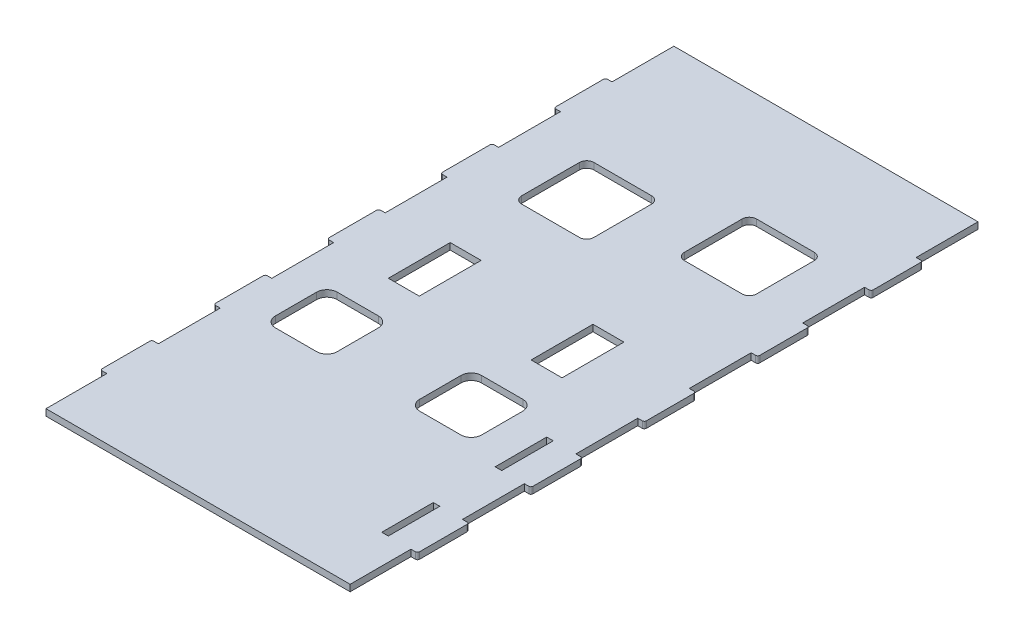
from build123d import *

# Parameters (mm, degrees)
BOSS_EXTRUDE1_DEPTH = 6.35
FILLET1_R           = 2
SKETCH2_W           = 6.35
SKETCH2_H           = 50
SKETCH2_W_2         = 30
SKETCH2_H_2         = 60
CUT_EXTRUDE1_DEPTH  = 6.35


with BuildPart() as part:
    # Sketch1 → Boss-Extrude1 (new body)
    with BuildSketch(Plane(origin=(0, 0, 0), x_dir=(1, 0, 0), z_dir=(0, 1, 0))):
        Polygon((0, 0), (295, 0), (295, 59), (301.35, 59), (301.35, 109), (295, 109), (295, 169), (301.35, 169), (301.35, 219), (295, 219), (295, 279), (301.35, 279), (301.35, 329), (295, 329), (295, 389), (301.35, 389), (301.35, 439), (295, 439), (295, 499), (301.35, 499), (301.35, 549), (295, 549), (295, 609), (0, 609), (0, 549), (-6.35, 549), (-6.35, 499), (0, 499), (0, 439), (-6.35, 439), (-6.35, 389), (0, 389), (0, 329), (-6.35, 329), (-6.35, 279), (0, 279), (0, 219), (-6.35, 219), (-6.35, 169), (0, 169), (0, 109), (-6.35, 109), (-6.35, 59), (0, 59), align=None)
    extrude(amount=BOSS_EXTRUDE1_DEPTH)

    # Fillet1
    fillet1_edges = [part.edges().sort_by_distance(p)[0] for p in [
        (301.35, 3.175, -549),
        (301.35, 3.175, -499),
        (301.35, 3.175, -439),
        (301.35, 3.175, -389),
        (301.35, 3.175, -329),
        (301.35, 3.175, -279),
        (301.35, 3.175, -219),
        (301.35, 3.175, -169),
        (301.35, 3.175, -109),
        (301.35, 3.175, -59),
        (-6.35, 3.175, -59),
        (-6.35, 3.175, -109),
        (-6.35, 3.175, -169),
        (-6.35, 3.175, -219),
        (-6.35, 3.175, -279),
        (-6.35, 3.175, -329),
        (-6.35, 3.175, -389),
        (-6.35, 3.175, -439),
        (-6.35, 3.175, -499),
        (-6.35, 3.175, -549),
    ]]
    fillet(fillet1_edges, radius=FILLET1_R)

    # Sketch2 → Cut-Extrude1 (cut)
    with BuildSketch(Plane(origin=(0, 6.35, 0), x_dir=(1, 0, 0), z_dir=(0, 1, 0))):
        with Locations((269.825, 194)):
            Rectangle(SKETCH2_W, SKETCH2_H)
        with Locations((269.825, 84)):
            Rectangle(SKETCH2_W, SKETCH2_H)
        with BuildLine():
            Line((58.849017766, 472.553782609), (114.849017766, 472.553782609))
            ThreePointArc((114.849017766, 472.553782609), (119.798765234, 470.503530077), (121.849017766, 465.553782609))
            Line((121.849017766, 465.553782609), (121.849017766, 409.553782609))
            ThreePointArc((121.849017766, 409.553782609), (119.798765234, 404.60403514), (114.849017766, 402.553782609))
            Line((114.849017766, 402.553782609), (58.849017766, 402.553782609))
            ThreePointArc((58.849017766, 402.553782609), (53.899270297, 404.60403514), (51.849017766, 409.553782609))
            Line((51.849017766, 409.553782609), (51.849017766, 465.553782609))
            ThreePointArc((51.849017766, 465.553782609), (53.899270297, 470.503530077), (58.849017766, 472.553782609))
        make_face()
        with BuildLine():
            Line((185.233522799, 503.969461472), (241.233522799, 503.969461472))
            ThreePointArc((241.233522799, 503.969461472), (246.183270267, 501.91920894), (248.233522799, 496.969461472))
            Line((248.233522799, 496.969461472), (248.233522799, 440.969461472))
            ThreePointArc((248.233522799, 440.969461472), (246.183270267, 436.019714004), (241.233522799, 433.969461472))
            Line((241.233522799, 433.969461472), (185.233522799, 433.969461472))
            ThreePointArc((185.233522799, 433.969461472), (180.283775331, 436.019714004), (178.233522799, 440.969461472))
            Line((178.233522799, 440.969461472), (178.233522799, 496.969461472))
            ThreePointArc((178.233522799, 496.969461472), (180.283775331, 501.91920894), (185.233522799, 503.969461472))
        make_face()
        with BuildLine():
            Line((43.325, 239.143159068), (83.325, 239.143159068))
            ThreePointArc((83.325, 239.143159068), (90.396067812, 236.21422688), (93.325, 229.143159068))
            Line((93.325, 229.143159068), (93.325, 189.143159068))
            ThreePointArc((93.325, 189.143159068), (90.396067812, 182.072091256), (83.325, 179.143159068))
            Line((83.325, 179.143159068), (43.325, 179.143159068))
            ThreePointArc((43.325, 179.143159068), (36.253932188, 182.072091256), (33.325, 189.143159068))
            Line((33.325, 189.143159068), (33.325, 229.143159068))
            ThreePointArc((33.325, 229.143159068), (36.253932188, 236.21422688), (43.325, 239.143159068))
        make_face()
        with Locations((71.473965374, 305.574146312)):
            Rectangle(SKETCH2_W_2, SKETCH2_H_2)
        with Locations((209.35573951, 306.193400943)):
            Rectangle(SKETCH2_W_2, SKETCH2_H_2)
        with BuildLine():
            Line((173.325, 229.143159068), (173.325, 189.143159068))
            ThreePointArc((173.325, 189.143159068), (176.253932188, 182.072091256), (183.325, 179.143159068))
            Line((183.325, 179.143159068), (223.325, 179.143159068))
            ThreePointArc((223.325, 179.143159068), (230.396067812, 182.072091256), (233.325, 189.143159068))
            Line((233.325, 189.143159068), (233.325, 229.143159068))
            ThreePointArc((233.325, 229.143159068), (230.396067812, 236.21422688), (223.325, 239.143159068))
            Line((223.325, 239.143159068), (183.325, 239.143159068))
            ThreePointArc((183.325, 239.143159068), (176.253932188, 236.21422688), (173.325, 229.143159068))
        make_face()
    extrude(amount=-CUT_EXTRUDE1_DEPTH, mode=Mode.SUBTRACT)


solid = part.part
